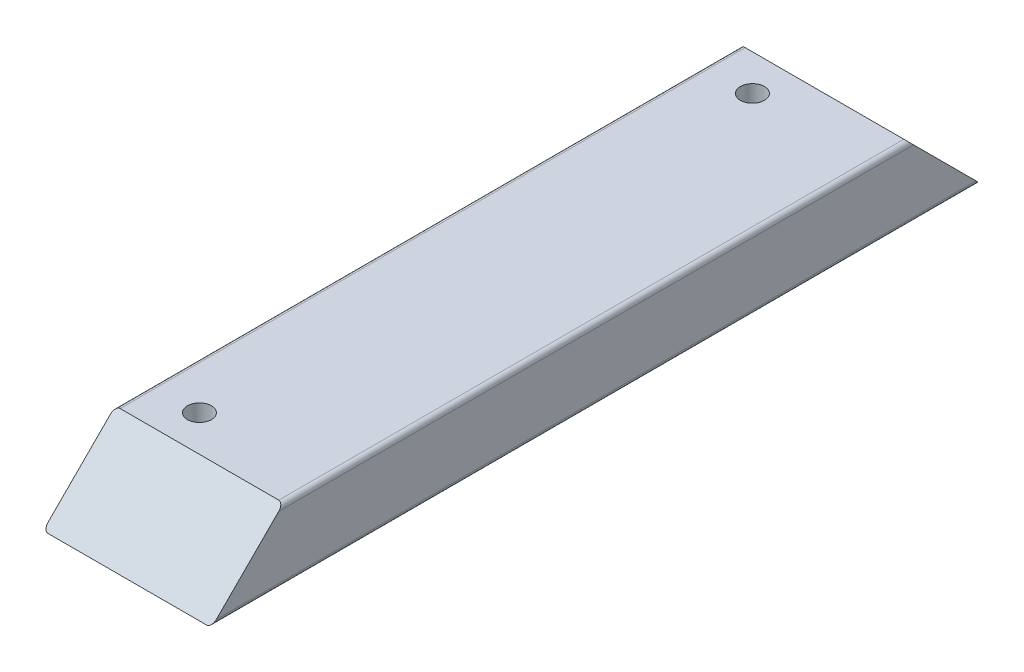
from build123d import *

# Parameters (mm, degrees)
SKETCH1_W           = 88.9
SKETCH1_H           = 38.1
BOSS_EXTRUDE1_DEPTH = 406.4
FILLET1_R           = 2.54
CUT_EXTRUDE1_DEPTH  = 406.4
SKETCH3_R           = 6.35
CUT_EXTRUDE2_DEPTH  = 406.4


with BuildPart() as part:
    # Sketch1 → Boss-Extrude1 (new body)
    with BuildSketch(Plane.XY):
        Rectangle(SKETCH1_W, SKETCH1_H)
    extrude(amount=BOSS_EXTRUDE1_DEPTH)

    # Fillet1
    fillet1_edges = [part.edges().sort_by_distance(p)[0] for p in [
        (-44.45, -19.05, 203.2),
        (44.45, -19.05, 203.2),
        (44.45, 19.05, 203.2),
        (-44.45, 19.05, 203.2),
    ]]
    fillet(fillet1_edges, radius=FILLET1_R)

    # Sketch2 → Cut-Extrude1 (cut)
    with BuildSketch(Plane.ZY.offset(44.45)):
        Polygon((0, 19.05), (0, -19.05), (38.1, 19.05), align=None)
    cut_extrude1 = extrude(amount=-CUT_EXTRUDE1_DEPTH, mode=Mode.SUBTRACT)

    # Mirror1: Cut-Extrude1 across plane
    add(cut_extrude1.mirror(Plane.XY.offset(203.2)), mode=Mode.SUBTRACT)

    # Sketch3 → Cut-Extrude2 (cut)
    with BuildSketch(Plane(origin=(0, 19.05, 0), x_dir=(1, 0, 0), z_dir=(0, 1, 0))):
        with Locations((-19.05, -57.15)):
            Circle(SKETCH3_R)
    cut_extrude2 = extrude(amount=-CUT_EXTRUDE2_DEPTH, mode=Mode.SUBTRACT)

    # Mirror4: Cut-Extrude2 across plane
    add(cut_extrude2.mirror(Plane.XY.offset(203.2)), mode=Mode.SUBTRACT)


solid = part.part
